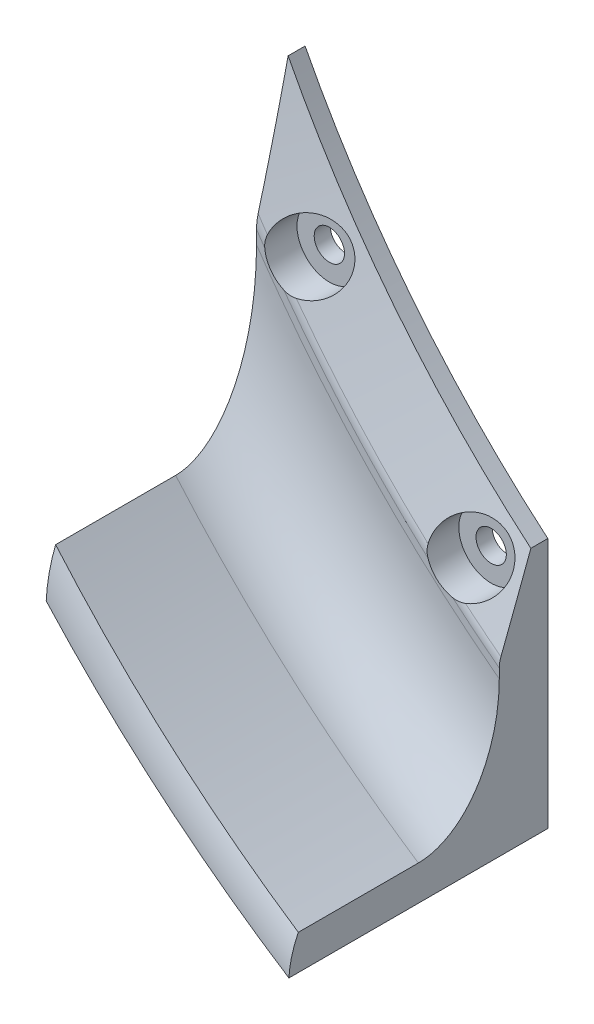
from build123d import *

# Parameters (mm, degrees)
SKETCH1_R               = 2.38125
BOSS_EXTRUDE1_DEPTH     = 3.175
BOSS_EXTRUDE2_DEPTH     = 50.8
CUT_EXTRUDE1_DEPTH      = 209.526843613
CUT_EXTRUDE1_DEPTH_BACK = 209.526843613
SKETCH3_R               = 203.829254644
SKETCH3_R_2             = 174.625
SKETCH5_R               = 2.38125
CUT_EXTRUDE3_DEPTH      = 200.484174202
SKETCH6_W               = 205.731089426
SKETCH6_H               = 25.4
BOSS_EXTRUDE3_DEPTH     = 3.175
SKETCH8_R               = 2.38125
CUT_EXTRUDE5_DEPTH      = 200.484174202
SKETCH9_W               = 205.731089426
SKETCH9_H               = 38.1
BOSS_EXTRUDE4_DEPTH     = 3.175
SKETCH10_R              = 6.35
SKETCH10_R_2            = 2.38125
CUT_EXTRUDE6_DEPTH      = 200.484174202
SKETCH11_W              = 53.331089426
SKETCH11_H              = 31.75
BOSS_EXTRUDE5_DEPTH     = 3.175
FILLET1_R               = 10.16
SKETCH12_R              = 6.35
SKETCH12_R_2            = 2.38125
CUT_EXTRUDE7_DEPTH      = 200.484174202
FILLET2_R               = 2.54
CUT_EXTRUDE8_DEPTH      = 200.484174202
SKETCH14_W              = 2.759281453
SKETCH14_H              = 7.963584416
SKETCH14_W_2            = 2.527010149
SKETCH14_H_2            = 5.938870156
BOSS_EXTRUDE6_DEPTH     = 3.175
FILLET3_R               = 2.54
SKETCH15_R              = 2.38125
BOSS_EXTRUDE7_DEPTH     = 40.64
SKETCH16_R              = 227.754671792
SKETCH16_W              = 368.539826918
SKETCH16_H              = 147.114866813
CUT_EXTRUDE9_DEPTH      = 218.328838711
SKETCH17_R              = 87.195519402
CUT_EXTRUDE10_DEPTH     = 218.328838646
CHAMFER1_SIZE           = 27.94
CHAMFER1_SIZE_2         = 31.030513664
CUT_EXTRUDE12_START     = -2.54
SKETCH18_R              = 5.08
CUT_EXTRUDE12_DEPTH     = 33.02
FILLET4_R               = 10.16
CUT_EXTRUDE13_START     = -7.62
SKETCH20_R              = 185.916878671
CUT_EXTRUDE13_DEPTH     = 210.708838803
FILLET5_SIZE            = 12.7
FILLET5_SIZE_2          = 15.24
CHAMFER2_SIZE           = 10.16
CHAMFER2_SIZE_2         = 4.9553631
FILLET6_R               = 2.54


with BuildPart() as part:
    # Sketch1 → Boss-Extrude1 (new body)
    with BuildSketch(Plane.XY):
        with BuildLine():
            Line((-102.865544713, 31.75), (-102.865544713, 145.022480019))
            ThreePointArc((-102.865544713, 145.022480019), (-123.286100955, 128.114703728), (-140.965544713, 108.358457002))
            Line((-140.965544713, 108.358457002), (-140.965544713, -108.358457002))
            ThreePointArc((-140.965544713, -108.358457002), (-123.286100955, -128.114703728), (-102.865544713, -145.022480019))
            Line((-102.865544713, -145.022480019), (-102.865544713, -69.85))
            Line((-102.865544713, -69.85), (102.865544713, -69.85))
            Line((102.865544713, -69.85), (102.865544713, -145.022480019))
            ThreePointArc((102.865544713, -145.022480019), (123.286100955, -128.114703728), (140.965544713, -108.358457002))
            Line((140.965544713, -108.358457002), (140.965544713, 108.358457002))
            ThreePointArc((140.965544713, 108.358457002), (123.286100955, 128.114703728), (102.865544713, 145.022480019))
            Line((102.865544713, 145.022480019), (102.865544713, 31.75))
            Line((102.865544713, 31.75), (-102.865544713, 31.75))
        make_face()
        with Locations((25.4, -38.1)):
            Circle(SKETCH1_R, mode=Mode.SUBTRACT)
        with Locations((-25.4, -38.1)):
            Circle(SKETCH1_R, mode=Mode.SUBTRACT)
        with Locations((0, -38.1)):
            Circle(SKETCH1_R, mode=Mode.SUBTRACT)
    extrude(amount=BOSS_EXTRUDE1_DEPTH)

    # Sketch2 → Boss-Extrude2 (add)
    with BuildSketch(Plane.XY.offset(3.175)):
        with BuildLine():
            ThreePointArc((-102.865544713, -141.111907137), (-123.390730203, -123.566250752), (-140.965544713, -103.06602655))
            Line((-140.965544713, -103.06602655), (-140.965544713, -108.358457002))
            ThreePointArc((-140.965544713, -108.358457002), (-123.286100955, -128.114703728), (-102.865544713, -145.022480019))
            Line((-102.865544713, -145.022480019), (-102.865544713, -141.111907137))
        make_face()
        with BuildLine():
            ThreePointArc((140.965544713, -103.06602655), (123.390730203, -123.566250752), (102.865544713, -141.111907137))
            Line((102.865544713, -141.111907137), (102.865544713, -145.022480019))
            ThreePointArc((102.865544713, -145.022480019), (123.286100955, -128.114703728), (140.965544713, -108.358457002))
            Line((140.965544713, -108.358457002), (140.965544713, -103.06602655))
        make_face()
    extrude(amount=BOSS_EXTRUDE2_DEPTH)

    # Sketch3 → Cut-Extrude1 (cut, two sides: drawn at the far end of the back side and taken through both)
    with BuildSketch(Plane.XY.offset(3.175).offset(-CUT_EXTRUDE1_DEPTH_BACK)):
        Circle(SKETCH3_R)
        Circle(SKETCH3_R_2, mode=Mode.SUBTRACT)
    extrude(amount=CUT_EXTRUDE1_DEPTH + CUT_EXTRUDE1_DEPTH_BACK, mode=Mode.SUBTRACT)

    # Sketch5 → Cut-Extrude3 (cut, through all)
    with BuildSketch(Plane.XY.offset(3.175)):
        with Locations((134.615544713, -95.585904409)):
            Circle(SKETCH5_R)
        with Locations((109.215544713, -123.814275401)):
            Circle(SKETCH5_R)
        with Locations(Location((-134.615544713, -95.585904409, 0), (0, 0, 180))):
            Circle(SKETCH5_R)
        with Locations(Location((-109.215544713, -123.814275401, 0), (0, 0, 180))):
            Circle(SKETCH5_R)
    extrude(amount=-CUT_EXTRUDE3_DEPTH, mode=Mode.SUBTRACT)

    # Sketch6 → Boss-Extrude3 (add)
    with BuildSketch(Plane.XY.offset(3.175)):
        with Locations((0, 77.611907137)):
            Rectangle(SKETCH6_W, SKETCH6_H)
    extrude(amount=-BOSS_EXTRUDE3_DEPTH)

    # Sketch8 → Cut-Extrude5 (cut, through all)
    with BuildSketch(Plane.XY.offset(3.175)):
        with Locations((-38.1, -38.1)):
            Circle(SKETCH8_R)
        with Locations((-50.8, -38.1)):
            Circle(SKETCH8_R)
        with Locations((12.7, -38.1)):
            Circle(SKETCH8_R)
        with Locations((-12.7, -38.1)):
            Circle(SKETCH8_R)
    extrude(amount=-CUT_EXTRUDE5_DEPTH, mode=Mode.SUBTRACT)

    # Sketch9 → Boss-Extrude4 (add)
    with BuildSketch(Plane.XY.offset(3.175)):
        with Locations((0, -88.9)):
            Rectangle(SKETCH9_W, SKETCH9_H)
    extrude(amount=-BOSS_EXTRUDE4_DEPTH)

    # Sketch10 → Cut-Extrude6 (cut, through all)
    with BuildSketch(Plane.XY.offset(3.175)):
        with Locations((0, -76.2)):
            Circle(SKETCH10_R)
        with Locations((-25.4, -76.2)):
            Circle(SKETCH10_R_2)
        with Locations((-38.1, -76.2)):
            Circle(SKETCH10_R_2)
        with Locations((25.4, -76.2)):
            Circle(SKETCH10_R_2)
    extrude(amount=-CUT_EXTRUDE6_DEPTH, mode=Mode.SUBTRACT)

    # Sketch11 → Boss-Extrude5 (add)
    with BuildSketch(Plane.XY.offset(3.175)):
        with Locations((0, -123.825)):
            Rectangle(SKETCH11_W, SKETCH11_H)
    extrude(amount=-BOSS_EXTRUDE5_DEPTH)

    # Fillet1
    fillet1_edges = [part.edges().sort_by_distance(p)[0] for p in [
        (-26.665544713, -139.7, 1.5875),
        (-26.665544713, -107.95, 1.5875),
        (26.665544713, -107.95, 1.5875),
        (26.665544713, -139.7, 1.5875),
    ]]
    fillet(fillet1_edges, radius=FILLET1_R)

    # Sketch12 → Cut-Extrude7 (cut, through all)
    with BuildSketch(Plane.XY.offset(3.175)):
        with Locations((-25.4, -76.2)):
            Circle(SKETCH12_R)
        with Locations((25.4, -76.2)):
            Circle(SKETCH12_R)
        with Locations((-8.66775, -67.53225)):
            Circle(SKETCH12_R_2)
        with Locations((8.66775, -67.53225)):
            Circle(SKETCH12_R_2)
        with Locations((8.66775, -84.86775)):
            Circle(SKETCH12_R_2)
        with Locations((-8.66775, -84.86775)):
            Circle(SKETCH12_R_2)
    extrude(amount=-CUT_EXTRUDE7_DEPTH, mode=Mode.SUBTRACT)

    # Fillet2
    fillet2_edges = [part.edges().sort_by_distance(p)[0] for p in [
        (-102.865544713, 141.111907137, 1.5875),
        (102.865544713, 141.111907137, 1.5875),
    ]]
    fillet(fillet2_edges, radius=FILLET2_R)

    # Sketch13 → Cut-Extrude8 (cut, through all)
    # profile 1 of 4: a face of its own
    with BuildSketch(Plane.XY.offset(3.175)):
        with BuildLine():
            Line((-29.807958333, -15.810565048), (-38.216416667, -15.810565048))
            Line((-38.216416667, -15.810565048), (-33.538583333, 6.245101619))
            Line((-33.538583333, 6.245101619), (-38.803791667, 6.245101619))
            Line((-38.803791667, 6.245101619), (-39.682208333, 2.075268285))
            Line((-39.682208333, 2.075268285), (-48.095958333, 2.075268285))
            Line((-48.095958333, 2.075268285), (-47.397458333, 5.477809952))
            add(Edge.make_bspline(
                [(-47.397458333, 5.477809952), (-47.320569058, 5.758194134), (-47.170922216, 6.303895823), (-46.789013651, 7.053374007), (-46.29771223, 7.715065901), (-45.690436731, 8.272796577), (-45.006500067, 8.730292102), (-44.253147871, 9.054960677), (-43.448405111, 9.260244914), (-42.891974442, 9.282012228), (-42.6085, 9.293101619)],
                knots=[0, 0, 0, 0, 1.050168006, 2.043904372, 3.024673376, 4.01863537, 5.013909092, 5.989008141, 6.975497172, 8, 8, 8, 8], degree=3))
            Line((-42.6085, 9.293101619), (-24.463375, 9.293101619))
            Line((-24.463375, 9.293101619), (-29.807958333, -15.810565048))
        make_face()
    # profile 2 of 4: a face of its own
    with BuildSketch(Plane.XY.offset(3.175)):
        with BuildLine():
            add(Edge.make_bspline(
                [(-3.566583333, -12.132856715), (-3.643765668, -12.421811436), (-3.79437451, -12.985659844), (-4.17293599, -13.764550451), (-4.665381385, -14.453577746), (-5.270434906, -15.036263062), (-5.950809803, -15.518035961), (-6.703009887, -15.859816489), (-7.511777843, -16.068702787), (-8.070292693, -16.093985699), (-8.355541667, -16.106898381)],
                knots=[0, 0, 0, 0, 1.062369753, 2.073042759, 3.062499936, 4.061251344, 5.048575831, 6.014824268, 6.986115874, 8, 8, 8, 8], degree=3))
            Line((-8.355541667, -16.106898381), (-22.547791667, -16.106898381))
            add(Edge.make_bspline(
                [(-22.547791667, -16.106898381), (-22.69262218, -16.104596964), (-22.972752339, -16.100145578), (-23.378206431, -16.044702396), (-23.755568174, -15.960682303), (-24.107157142, -15.846746121), (-24.426210233, -15.691540895), (-24.716954418, -15.504453058), (-24.976786635, -15.281711317), (-25.203806964, -15.025677099), (-25.40308213, -14.746169713), (-25.554358436, -14.435544628), (-25.674211179, -14.106195373), (-25.74344938, -13.752832717), (-25.791514529, -13.37950469), (-25.77975916, -12.981941289), (-25.73922686, -12.562383844), (-25.682974686, -12.278883611), (-25.654, -12.132856715)],
                knots=[0, 0, 0, 0, 1.158779845, 2.241303809, 3.269110906, 4.251580925, 5.192683609, 6.101443689, 7.012833415, 7.922909267, 8.835720222, 9.751475912, 10.680528402, 11.633319635, 12.628295421, 13.687540584, 14.808885378, 16, 16, 16, 16], degree=3))
            Line((-25.654, -12.132856715), (-21.997458333, 5.319059952))
            add(Edge.make_bspline(
                [(-21.997458333, 5.319059952), (-21.920272116, 5.608009048), (-21.769655695, 6.171846477), (-21.391148554, 6.950815808), (-20.898502375, 7.639552216), (-20.293153244, 8.224337096), (-19.608609326, 8.702683082), (-18.855913228, 9.046275843), (-18.048644228, 9.254382857), (-17.4919553, 9.28003834), (-17.2085, 9.293101619)],
                knots=[0, 0, 0, 0, 1.062516124, 2.073328378, 3.062921881, 4.061810895, 5.05442655, 6.020808115, 6.992233544, 8, 8, 8, 8], degree=3))
            Line((-17.2085, 9.293101619), (-3.01625, 9.293101619))
            add(Edge.make_bspline(
                [(-3.01625, 9.293101619), (-2.871419505, 9.290800192), (-2.591289383, 9.286348788), (-2.185835038, 9.230905733), (-1.808474182, 9.146885197), (-1.456882118, 9.03295056), (-1.137839887, 8.877739913), (-0.847056821, 8.690671483), (-0.587369032, 8.467857656), (-0.359809395, 8.212092615), (-0.16209325, 7.930921186), (-0.002983257, 7.623293687), (0.114459046, 7.2921344), (0.187047795, 6.939473562), (0.223589985, 6.565305639), (0.223678302, 6.168188246), (0.179743785, 5.748571863), (0.123975462, 5.465081675), (0.09525, 5.319059952)],
                knots=[0, 0, 0, 0, 1.158432062, 2.24063113, 3.268129752, 4.250304904, 5.191125136, 6.099612471, 7.010728663, 7.920531375, 8.833068369, 9.75494936, 10.683723015, 11.636228288, 12.62940148, 13.688234619, 14.809242866, 16, 16, 16, 16], degree=3))
            Line((0.09525, 5.319059952), (-3.566583333, -12.132856715))
        make_face()
        Polygon((-13.403791667, 6.245101619), (-17.425458333, -13.058898381), (-12.16025, -13.058898381), (-8.138583333, 6.245101619), align=None, mode=Mode.SUBTRACT)
    # profile 3 of 4: a face of its own
    with BuildSketch(Plane.XY.offset(3.175)):
        with BuildLine():
            Line((11.557, 9.293101619), (8.556625, -5.269565048))
            Line((8.556625, -5.269565048), (13.827125, -5.269565048))
            Line((13.827125, -5.269565048), (16.8275, 9.293101619))
            Line((16.8275, 9.293101619), (25.235958333, 9.293101619))
            Line((25.235958333, 9.293101619), (19.896666667, -16.106898381))
            Line((19.896666667, -16.106898381), (11.482916667, -16.106898381))
            Line((11.482916667, -16.106898381), (13.165666667, -8.317565048))
            Line((13.165666667, -8.317565048), (3.439583333, -8.317565048))
            add(Edge.make_bspline(
                [(3.439583333, -8.317565048), (3.294736233, -8.315312365), (3.014573993, -8.310955241), (2.609344629, -8.25485176), (2.230636814, -8.173029355), (1.881290806, -8.050712181), (1.561052368, -7.897312045), (1.270346477, -7.709804396), (1.009103929, -7.48515858), (0.777806767, -7.227358437), (0.580756638, -6.941550122), (0.426179112, -6.6292081), (0.309007624, -6.297036788), (0.237889907, -5.94070984), (0.190785312, -5.563660832), (0.202000265, -5.162620664), (0.243321079, -4.739613917), (0.29915982, -4.45427987), (0.328083333, -4.306481715)],
                knots=[0, 0, 0, 0, 1.152191709, 2.228561082, 3.250524676, 4.231939746, 5.167691878, 6.071285285, 6.977493388, 7.902223819, 8.821393841, 9.731943086, 10.66895861, 11.616332835, 12.619603957, 13.686867372, 14.801836863, 16, 16, 16, 16], degree=3))
            Line((0.328083333, -4.306481715), (3.14325, 9.293101619))
            Line((3.14325, 9.293101619), (11.557, 9.293101619))
        make_face()
    # profile 4 of 4: a face of its own
    with BuildSketch(Plane.XY.offset(3.175)):
        with BuildLine():
            Line((33.374541667, -13.058898381), (47.0535, -13.058898381))
            Line((47.0535, -13.058898381), (46.392041667, -16.106898381))
            Line((46.392041667, -16.106898381), (24.304625, -16.106898381))
            Line((24.304625, -16.106898381), (25.802166667, -9.143065048))
            add(Edge.make_bspline(
                [(25.802166667, -9.143065048), (25.879273752, -8.861031474), (26.029757165, -8.310610268), (26.410334887, -7.552072135), (26.901419327, -6.879703753), (27.508831265, -6.311820899), (28.191228528, -5.842472815), (28.946271137, -5.513745702), (29.752164487, -5.300517366), (30.311046908, -5.28002739), (30.596416667, -5.269565048)],
                knots=[0, 0, 0, 0, 1.049169808, 2.047576474, 3.031944376, 4.027910562, 5.023553593, 5.994653504, 6.976054309, 8, 8, 8, 8], degree=3))
            Line((30.596416667, -5.269565048), (40.3225, -5.269565048))
            Line((40.3225, -5.269565048), (42.661416667, 6.245101619))
            Line((42.661416667, 6.245101619), (37.396208333, 6.245101619))
            Line((37.396208333, 6.245101619), (36.517791667, 2.075268285))
            Line((36.517791667, 2.075268285), (28.104041667, 2.075268285))
            Line((28.104041667, 2.075268285), (28.802541667, 5.477809952))
            add(Edge.make_bspline(
                [(28.802541667, 5.477809952), (28.879430942, 5.758194134), (29.029077784, 6.303895823), (29.410986349, 7.053374007), (29.90228777, 7.715065901), (30.509563269, 8.272796577), (31.193499933, 8.730292102), (31.946852129, 9.054960677), (32.751594889, 9.260244914), (33.308025558, 9.282012228), (33.5915, 9.293101619)],
                knots=[0, 0, 0, 0, 1.050168006, 2.043904372, 3.024673376, 4.01863537, 5.013909092, 5.989008141, 6.975497172, 8, 8, 8, 8], degree=3))
            Line((33.5915, 9.293101619), (47.78375, 9.293101619))
            add(Edge.make_bspline(
                [(47.78375, 9.293101619), (47.92859726, 9.290849086), (48.208759811, 9.286492252), (48.613987002, 9.230386738), (48.992702458, 9.148571481), (49.342021711, 9.026229282), (49.662353678, 8.87291663), (49.952725098, 8.685096123), (50.214324347, 8.462382804), (50.440285412, 8.20121114), (50.636405741, 7.915869715), (50.798510828, 7.606235104), (50.913345969, 7.272328086), (50.987754572, 6.916671215), (51.023365934, 6.538801464), (51.023963511, 6.138199286), (50.97928388, 5.715135649), (50.923924969, 5.429811378), (50.89525, 5.282018285)],
                knots=[0, 0, 0, 0, 1.152517565, 2.229191352, 3.251443972, 4.233136601, 5.169153376, 6.073002333, 6.979466726, 7.895134038, 8.814564014, 9.731738245, 10.66901877, 11.616660927, 12.618740334, 13.686213184, 14.801498005, 16, 16, 16, 16], degree=3))
            Line((50.89525, 5.282018285), (48.916166667, -4.306481715))
            add(Edge.make_bspline(
                [(48.916166667, -4.306481715), (48.838706266, -4.597052385), (48.687148602, -5.165577869), (48.311448965, -5.952788492), (47.817473721, -6.648200027), (47.212376239, -7.235653604), (46.533647997, -7.724482215), (45.778706123, -8.063324207), (44.971906745, -8.281163221), (44.41262475, -8.30526518), (44.127208333, -8.317565048)],
                knots=[0, 0, 0, 0, 1.06412456, 2.082047477, 3.072647496, 4.071792832, 5.058775816, 6.021176094, 6.990153746, 8, 8, 8, 8], degree=3))
            Line((44.127208333, -8.317565048), (34.395833333, -8.317565048))
            Line((34.395833333, -8.317565048), (33.374541667, -13.058898381))
        make_face()
    extrude(amount=-CUT_EXTRUDE8_DEPTH, mode=Mode.SUBTRACT)


with BuildPart() as cut_extrude8_piece_1:
    # of the separate pieces the step leaves, piece 1, a body of its own (cut_extrude8_pieces)
    add(part.part.solids().sort_by_distance((-106.961346111, 138.033188267, 0))[0])



with BuildPart() as cut_extrude8_piece_2:
    # of the separate pieces the step leaves, piece 2, a body of its own (cut_extrude8_pieces)
    add(part.part.solids().sort_by_distance((-8.138583333, 6.245101619, 0))[0])


with BuildPart() as cut_extrude8_piece_1_1:
    add(cut_extrude8_piece_1.part)

    add(cut_extrude8_piece_2.part)  # Boss-Extrude6 merges Cut-Extrude8 piece 2
    # Sketch14 → Boss-Extrude6 (add)
    with BuildSketch(Plane.XY.offset(3.175)):
        with Locations((-11.017521916, 7.88967512)):
            Rectangle(SKETCH14_W, SKETCH14_H)
        with Locations((-14.795211944, -14.779945163)):
            Rectangle(SKETCH14_W_2, SKETCH14_H_2)
    extrude(amount=-BOSS_EXTRUDE6_DEPTH)

    # Fillet3
    fillet3_edges = [cut_extrude8_piece_1_1.edges().sort_by_distance(p)[0] for p in [
        (102.865544713, 90.311907137, 1.5875),
        (102.865544713, 31.75, 1.5875),
        (-102.865544713, 64.911907137, 1.5875),
        (-102.865544713, 31.75, 1.5875),
        (-102.865544713, 90.311907137, 1.5875),
        (102.865544713, 64.911907137, 1.5875),
    ]]
    fillet(fillet3_edges, radius=FILLET3_R)

    # Sketch15 → Boss-Extrude7 (add)
    # profile 1 of 2: a face of its own
    with BuildSketch(Plane.XY.offset(3.175)):
        with BuildLine():
            ThreePointArc((-102.865544713, -120.914193587), (-124.246259111, -98.815128381), (-140.965544713, -73.008750871))
            Line((-140.965544713, -73.008750871), (-140.965544713, -128.136510034))
            ThreePointArc((-140.965544713, -128.136510034), (-122.97425317, -145.49083496), (-102.865544713, -160.340044003))
            Line((-102.865544713, -160.340044003), (-102.865544713, -120.914193587))
        make_face()
        with Locations((-109.215544713, -123.814275401)):
            Circle(SKETCH15_R, mode=Mode.SUBTRACT)
        with Locations((-134.615544713, -95.585904409)):
            Circle(SKETCH15_R, mode=Mode.SUBTRACT)
    # profile 2 of 2: a face of its own
    with BuildSketch(Plane.XY.offset(3.175)):
        with BuildLine():
            Line((140.965544713, -128.136510034), (140.965544713, -73.008750871))
            ThreePointArc((140.965544713, -73.008750871), (124.246259111, -98.815128381), (102.865544713, -120.914193587))
            Line((102.865544713, -120.914193587), (102.865544713, -160.340044003))
            ThreePointArc((102.865544713, -160.340044003), (122.97425317, -145.49083496), (140.965544713, -128.136510034))
        make_face()
        with Locations((109.215544713, -123.814275401)):
            Circle(SKETCH15_R, mode=Mode.SUBTRACT)
        with Locations((134.615544713, -95.585904409)):
            Circle(SKETCH15_R, mode=Mode.SUBTRACT)
    extrude(amount=BOSS_EXTRUDE7_DEPTH)

    # Sketch16 → Cut-Extrude9 (cut, through all)
    with BuildSketch(Plane.XY.offset(3.175)):
        Circle(SKETCH16_R)
        with Locations((23.411183864, 115.93750226)):
            Rectangle(SKETCH16_W, SKETCH16_H)
    extrude(amount=-CUT_EXTRUDE9_DEPTH, mode=Mode.SUBTRACT)


with BuildPart() as cut_extrude9_piece_1:
    # of the separate pieces the step leaves, piece 1, a body of its own (cut_extrude9_pieces)
    add(cut_extrude8_piece_1_1.part.solids().sort_by_distance((-140.965544713, -128.136510034, 3.175))[0])

    # Chamfer1
    # the kernel refuses this chamfer: 31.030513664, 27.94 mm, written as the material it takes off along each edge
    with BuildSketch(Plane(origin=(0, 0, 43.815), x_dir=(-0.20017923188636447, -0.9797592944807337, 0), z_dir=(0.9797592944807337, -0.20017923188636447, 0))) as chamfer1_piece_1:
        Polygon((158.75 + CHAMFER1_SIZE, 0), (158.75, CHAMFER1_SIZE_2), (158.75, 0), align=None)
    revolve(axis=Axis((0, 0, 43.815), (0, 0, -1)), revolution_arc=79.913485183, mode=Mode.SUBTRACT)

    # Sketch18 → Cut-Extrude12 (cut)
    with BuildSketch(Plane(origin=(0, 0, 3.175), x_dir=(-1, 0, 0), z_dir=(0, 0, -1)).offset(CUT_EXTRUDE12_START)):
        with Locations((134.615544713, -95.585904409)):
            Circle(SKETCH18_R)
        with Locations((109.215544713, -123.814275401)):
            Circle(SKETCH18_R)
    extrude(amount=-CUT_EXTRUDE12_DEPTH, mode=Mode.SUBTRACT)

    # Fillet4
    # the kernel refuses this fillet: 10.16 mm, written as the material it takes off along each edge
    with BuildSketch(Plane(origin=(0, 0, 43.815), x_dir=(-0.4998842027499923, -0.8660922490364434, 0), z_dir=(0.8660922490364434, -0.4998842027499923, 0))) as fillet4_piece_1:
        with BuildLine():
            CenterArc((191.237667396, 10.133185423), FILLET4_R, 222, 43.836372996)
            Line((183.68731597, 3.334818462), (183.536308941, 3.198851123))
            Line((183.536308941, 3.198851123), (186.538992971, -0.135967339))
            Line((186.538992971, -0.135967339), (186.69, -0.2032))
            ThreePointArc((186.69, -0.2032), (188.595, -0.2032), (190.485246652, -0.202663708))
            Line((190.485246652, -0.202663708), (190.5, 0))
        make_face()
    revolve(axis=Axis((0, 0, 43.815), (0, 0, -1)), revolution_arc=22.482929592, mode=Mode.SUBTRACT)

    # Sketch20 → Cut-Extrude13 (cut, through all)
    with BuildSketch(Plane(origin=(0, 0, 3.175), x_dir=(-1, 0, 0), z_dir=(0, 0, -1)).offset(CUT_EXTRUDE13_START)):
        Circle(SKETCH20_R)
    extrude(amount=-CUT_EXTRUDE13_DEPTH, mode=Mode.SUBTRACT)

    # Fillet5
    # an asymmetric fillet: 15.24, 12.7 mm, written as the material it adds along each edge
    with BuildSketch(Plane(origin=(0, 0, 10.795), x_dir=(-0.37219545317255504, -0.9281543754342143, 0), z_dir=(0.9281543754342143, -0.37219545317255504, 0))) as fillet5_piece_1_section:
        with BuildLine():
            Bezier((185.916878671, -FILLET5_SIZE), (185.916878671, 0), (185.916878671 - FILLET5_SIZE_2, 0), weights=[1, 0.707106781, 1])
            Line((185.916878671 - FILLET5_SIZE_2, 0), (185.916878671, 0))
            Line((185.916878671, 0), (185.916878671, -FILLET5_SIZE))
        make_face()
    fillet5_piece_1 = revolve(axis=Axis((0, 0, 10.795), (0, 0, -1)), revolution_arc=39.198065471, mode=Mode.PRIVATE)
    fillet5_piece_1 = split(fillet5_piece_1, bisect_by=Plane(origin=(-140.965544713, -133.970271088, 13.593151192), z_dir=(1, 0, 0)), keep=Keep.TOP, mode=Mode.PRIVATE)
    fillet5_piece_1 = split(fillet5_piece_1, bisect_by=Plane(origin=(-102.865544713, -133.970271088, 13.593151192), z_dir=(-1, 0, 0)), keep=Keep.TOP, mode=Mode.PRIVATE)
    add(fillet5_piece_1)

    # Chamfer2
    # the kernel refuses this chamfer: 10.16, 4.9553631 mm, written as the material it takes off along each edge
    with BuildSketch(Plane(origin=(0, 0, 10.795), x_dir=(-0.5133970128163213, -0.8581512146651533, 0), z_dir=(0.8581512146651533, -0.5133970128163213, 0))) as chamfer2_piece_1:
        Polygon((158.75 + CHAMFER2_SIZE, 0), (158.75, CHAMFER2_SIZE_2), (158.75, 0), align=None)
    revolve(axis=Axis((0, 0, 10.795), (0, 0, -1)), revolution_arc=41.227627295, mode=Mode.SUBTRACT)

    # Fillet6
    # the kernel refuses this fillet: 2.54 mm, written as the material it takes off along each edge
    with BuildSketch(Plane(origin=(0, 0, 10.795), x_dir=(-0.8219286457205435, -0.5695904680943961, 0), z_dir=(0.5695904680943961, -0.8219286457205435, 0))) as fillet6_piece_1:
        with BuildLine():
            CenterArc((168.91 + FILLET6_R * 0.230868191133, FILLET6_R), FILLET6_R, 243.999999999, 26.000000001)
            Line((168.91 - FILLET6_R * 0.207502955669, FILLET6_R * 0.101205953707), (168.91, 0))
            Line((168.91, 0), (168.91 + FILLET6_R * 0.230868191133, 0))
        make_face()
    revolve(axis=Axis((0, 0, 10.795), (0, 0, -1)), revolution_arc=1.789016953, mode=Mode.SUBTRACT)
    with BuildSketch(Plane(origin=(0, 0, 10.795), x_dir=(-0.6020891736925713, -0.7984288490042157, 0), z_dir=(0.7984288490042157, -0.6020891736925713, 0))) as fillet6_piece_2:
        with BuildLine():
            CenterArc((168.91 + FILLET6_R * 0.230868191133, FILLET6_R), FILLET6_R, 243.999999999, 26.000000001)
            Line((168.91 - FILLET6_R * 0.207502955669, FILLET6_R * 0.101205953707), (168.91, 0))
            Line((168.91, 0), (168.91 + FILLET6_R * 0.230868191133, 0))
        make_face()
    revolve(axis=Axis((0, 0, 10.795), (0, 0, -1)), revolution_arc=3.739989845, mode=Mode.SUBTRACT)
    with BuildSketch(Plane(origin=(0, 0, 10.795), x_dir=(-0.6700488357917587, -0.7423170196446452, 0), z_dir=(0.7423170196446452, -0.6700488357917587, 0))) as fillet6_piece_3:
        with BuildLine():
            CenterArc((168.91 + FILLET6_R * 0.230868191133, FILLET6_R), FILLET6_R, 243.999999999, 26.000000001)
            Line((168.91 - FILLET6_R * 0.207502955669, FILLET6_R * 0.101205953707), (168.91, 0))
            Line((168.91, 0), (168.91 + FILLET6_R * 0.230868191133, 0))
        make_face()
    revolve(axis=Axis((0, 0, 10.795), (0, 0, -1)), revolution_arc=11.8963194, mode=Mode.SUBTRACT)


with BuildPart() as cut_extrude9_piece_2:
    # of the separate pieces the step leaves, piece 2, a body of its own (cut_extrude9_pieces)
    add(cut_extrude8_piece_1_1.part.solids().sort_by_distance((140.965544713, -73.008750871, 3.175))[0])

    # Sketch17 → Cut-Extrude10 (cut, through all)
    with BuildSketch(Plane.XY.offset(43.815)):
        with Locations((124.015012721, -121.332950523)):
            Circle(SKETCH17_R)
    extrude(amount=-CUT_EXTRUDE10_DEPTH, mode=Mode.SUBTRACT)


solid = cut_extrude9_piece_1.part
